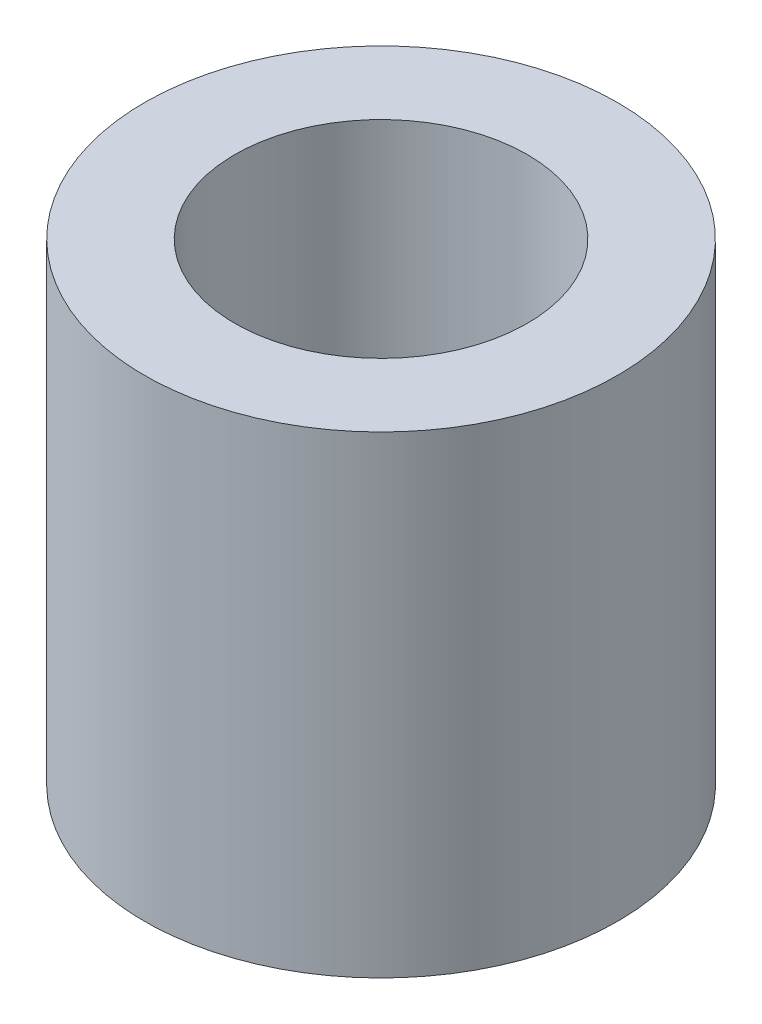
from build123d import *

# Parameters (mm, degrees)
SKETCH1_R           = 2.38125
SKETCH1_R_2         = 1.4732
BOSS_EXTRUDE1_DEPTH = 4.7625


with BuildPart() as part:
    # Sketch1 → Boss-Extrude1 (new body)
    with BuildSketch(Plane(origin=(0, 0, 0), x_dir=(1, 0, 0), z_dir=(0, 1, 0))):
        Circle(SKETCH1_R)
        Circle(SKETCH1_R_2, mode=Mode.SUBTRACT)
    extrude(amount=BOSS_EXTRUDE1_DEPTH)


solid = part.part
